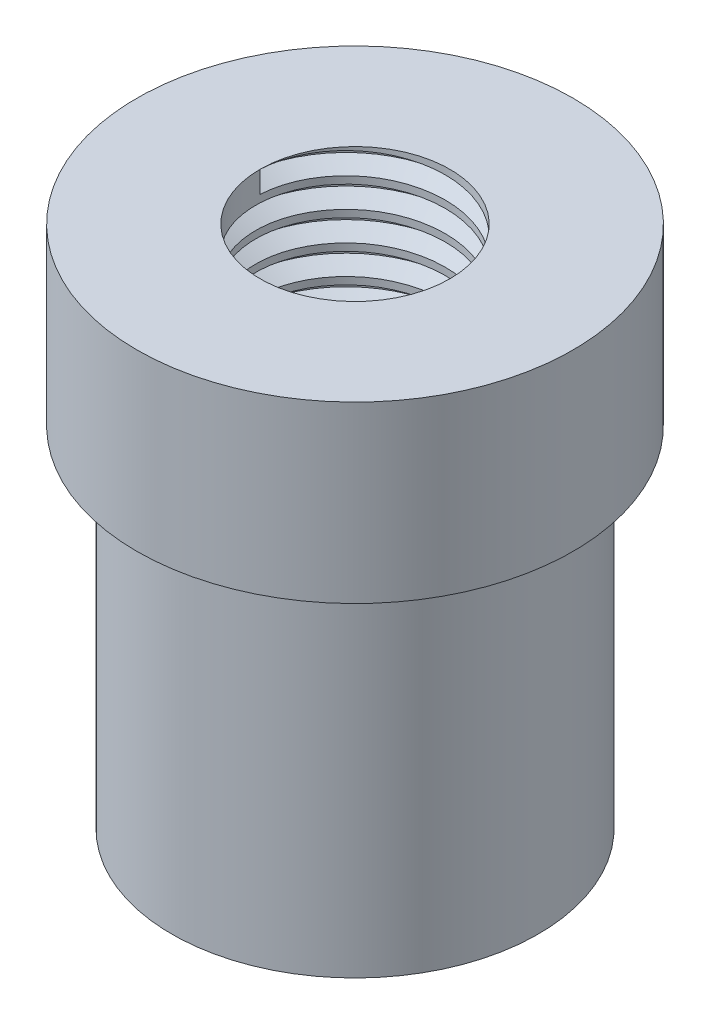
from build123d import *
from build123d.topology import SkipClean

# Parameters (mm, degrees)
SKETCH1_R               = 7.9375
BOSS_EXTRUDE1_DEPTH     = 6.35
SKETCH2_R               = 6.6675
BOSS_EXTRUDE2_DEPTH     = 12.7
CUT_EXTRUDE1_DEPTH      = 23.11131639
CUT_EXTRUDE1_DEPTH_BACK = 23.11131639
SKETCH5_R               = 3.4544
THREAD1_PITCH           = 1.058333333


with BuildPart() as part:
    # Sketch1 → Boss-Extrude1 (new body)
    with BuildSketch(Plane(origin=(0, 0, 0), x_dir=(1, 0, 0), z_dir=(0, 1, 0))):
        with Locations(Location((0, 0, 0), (0, 0, 270))):
            Circle(SKETCH1_R)
    extrude(amount=BOSS_EXTRUDE1_DEPTH)

    # Sketch2 → Boss-Extrude2 (add)
    with BuildSketch(Plane.XZ):
        with Locations(Location((0, 0, 0), (0, 0, 270))):
            Circle(SKETCH2_R)
    extrude(amount=BOSS_EXTRUDE2_DEPTH)

    # Sketch5 → Cut-Extrude1 (cut, two sides: drawn at the far end of the back side and taken through both)
    with BuildSketch(Plane(origin=(0, 6.35, 0), x_dir=(1, 0, 0), z_dir=(0, 1, 0)).offset(-CUT_EXTRUDE1_DEPTH_BACK)):
        with Locations(Location((0, 0, 0), (0, 0, 270))):
            Circle(SKETCH5_R)
    extrude(amount=CUT_EXTRUDE1_DEPTH + CUT_EXTRUDE1_DEPTH_BACK, mode=Mode.SUBTRACT)

    # Thread1: the profile of Thread Profile2 profile screwed along a right-hand helix of 48 turns, 8 arcs to a turn; built about Z, then put on its axis
    with SkipClean():  # the faces are left unmerged after this step: merging them gives an invalid solid
        thread1_z = Axis((0, 0, 0), (0, 0, 1))
        thread1_corners = [(3.4541, 0, -0.000173205), (4.027239718, 0, 0.330729165), (4.027239718, 0, 0.463020832), (3.4541, 0, 0.793923202)]
        with BuildLine(mode=Mode.PRIVATE) as thread1_profile:
            Line(thread1_corners[0], thread1_corners[1])
            Line(thread1_corners[1], thread1_corners[2])
            Line(thread1_corners[2], thread1_corners[3])
            Line(thread1_corners[3], thread1_corners[0])
        thread1_cap = Face(thread1_profile.wire())
        thread1_turn_angles = [0, 22.5, 45, 67.5, 90, 112.5, 135, 157.5, 180, 202.5, 225, 247.5, 270, 292.5, 315, 337.5, 360, 382.5, 405, 427.5, 450, 472.5, 495, 517.5, 540, 562.5, 585, 607.5, 630, 652.5, 675, 697.5, 720]
        thread1_turn_weights = [1, 0.9238795325112867, 1, 0.9238795325112867, 1, 0.9238795325112867, 1, 0.9238795325112867, 1, 0.9238795325112867, 1, 0.9238795325112867, 1, 0.9238795325112867, 1, 0.9238795325112867, 1, 0.9238795325112867, 1, 0.9238795325112867, 1, 0.9238795325112867, 1, 0.9238795325112867, 1, 0.9238795325112867, 1, 0.9238795325112867, 1, 0.9238795325112867, 1, 0.9238795325112867, 1]
        thread1_turn_rails = [Edge.make_bspline([Vector(p[0], p[1], 0).rotate(thread1_z, thread1_turn_angles[k]) / thread1_turn_weights[k] + Vector(0, 0, p[2] + THREAD1_PITCH * thread1_turn_angles[k] / 360) for k in range(33)], [0, 0, 0, 1, 1, 2, 2, 3, 3, 4, 4, 5, 5, 6, 6, 7, 7, 8, 8, 9, 9, 10, 10, 11, 11, 12, 12, 13, 13, 14, 14, 15, 15, 16, 16, 16], 2, thread1_turn_weights) for p in thread1_corners]
        thread1_turn_sides = [Face.make_surface_from_curves(thread1_turn_rails[p[0]], thread1_turn_rails[p[1]]) for p in [(0, 1), (1, 2), (2, 3), (3, 0)]]
        thread1 = Plane(origin=(0, 6.35, 0), x_dir=(-1, 0, 0), z_dir=(0, -1, 0)) * Solid(Shell([*[p.moved(Location((0, 0, 2 * THREAD1_PITCH * i))) for i in range(24) for p in thread1_turn_sides], thread1_cap, thread1_cap.rotate(thread1_z, 17280).moved(Location((0, 0, THREAD1_PITCH * 17280 / 360)))]))
        add(thread1, mode=Mode.SUBTRACT)


solid = part.part
